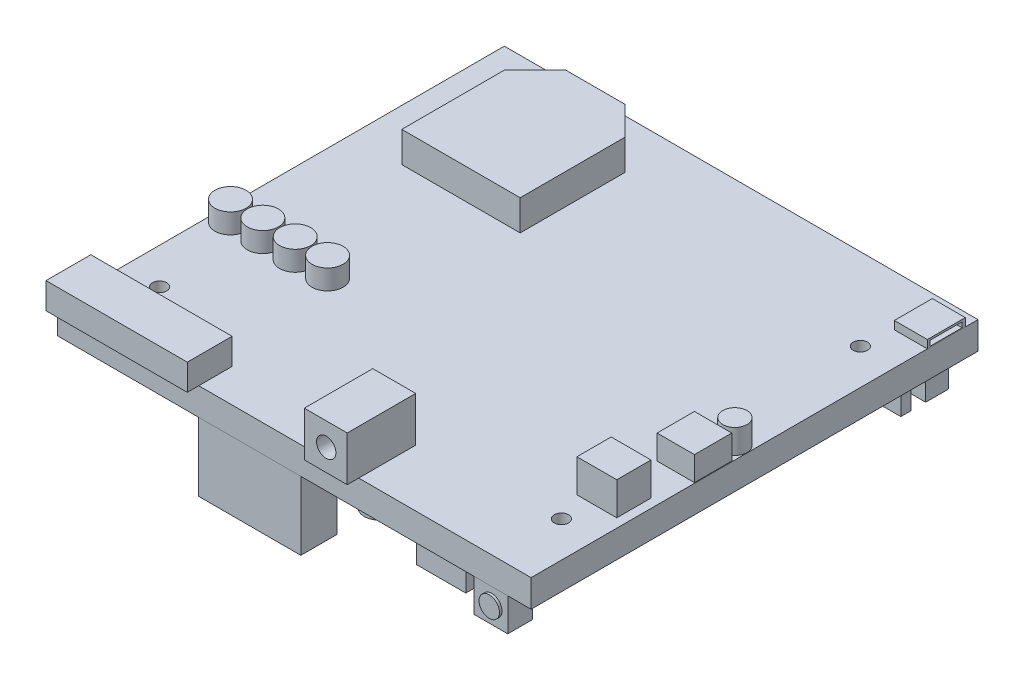
from build123d import *

# Parameters (mm, degrees)
SKETCH1_W             = 96.647
SKETCH1_H             = 91.186
BOSS_EXTRUDE1_DEPTH   = 5.588
BOSS_EXTRUDE2_DEPTH   = 6.223
SKETCH2_3_R           = 3.175
BOSS_EXTRUDE3_DEPTH   = 4.064
BOSS_EXTRUDE3_2_DEPTH = 4.064
BOSS_EXTRUDE3_3_DEPTH = 4.064
BOSS_EXTRUDE3_4_DEPTH = 4.064
SKETCH2_4_W           = 28.829
SKETCH2_4_H           = 9.144
BOSS_EXTRUDE4_DEPTH   = 5.334
SKETCH2_5_W           = 8.763
SKETCH2_5_H           = 13.97
BOSS_EXTRUDE5_DEPTH   = 9.144
SKETCH2_6_W           = 8.128
SKETCH2_6_H           = 6.985
BOSS_EXTRUDE6_DEPTH   = 6.731
SKETCH2_7_W           = 7.62
SKETCH2_7_H           = 7.62
BOSS_EXTRUDE7_DEPTH   = 4.953
SKETCH2_7_R           = 2.4765
BOSS_EXTRUDE7_2_DEPTH = 4.953
SKETCH2_8_W           = 6.731
SKETCH2_8_H           = 7.747
BOSS_EXTRUDE8_DEPTH   = 1.651
SKETCH3_W             = 20.32
SKETCH3_H             = 2.032
BOSS_EXTRUDE9_DEPTH   = 7.366
SKETCH3_H_2           = 4.699
BOSS_EXTRUDE9_2_DEPTH = 7.366
BOSS_EXTRUDE9_3_DEPTH = 7.366
BOSS_EXTRUDE9_4_DEPTH = 7.366
BOSS_EXTRUDE9_5_DEPTH = 7.366
BOSS_EXTRUDE9_6_DEPTH = 7.366
BOSS_EXTRUDE9_7_DEPTH = 7.366
BOSS_EXTRUDE9_8_DEPTH = 7.366
SKETCH4_W             = 20.828
SKETCH4_H             = 7.366
BOSS_EXTRUDE10_DEPTH  = 13.97
SKETCH5_W             = 25.019
SKETCH5_H             = 3.937
BOSS_EXTRUDE11_DEPTH  = 2.032
SKETCH6_R             = 3.048
BOSS_EXTRUDE12_DEPTH  = 6.35
SKETCH7_W             = 4.699
SKETCH7_H             = 4.699
BOSS_EXTRUDE13_DEPTH  = 1.651
SKETCH8_W             = 10.033
SKETCH8_H             = 10.033
BOSS_EXTRUDE14_DEPTH  = 5.08
SKETCH10_W            = 6.858
SKETCH10_H            = 5.08
BOSS_EXTRUDE15_DEPTH  = 6.731
SKETCH11_R            = 1.4605
CUT_EXTRUDE1_DEPTH    = 126.642876838
SKETCH13_W            = 6.502772336
SKETCH13_H            = 1.05238103
CUT_EXTRUDE3_DEPTH    = 2.54
SKETCH12_R            = 2.086347044
BOSS_EXTRUDE16_DEPTH  = 0.508
SKETCH14_R            = 1.973731767
CUT_EXTRUDE4_DEPTH    = 4.064


with BuildPart() as part:
    # Sketch1 → Boss-Extrude1 (new body)
    with BuildSketch(Plane(origin=(0, 0, 0), x_dir=(1, 0, 0), z_dir=(0, 1, 0))):
        with Locations((-36.848174165, 45.593)):
            Rectangle(SKETCH1_W, SKETCH1_H)
    extrude(amount=BOSS_EXTRUDE1_DEPTH)

    # Sketch2 → Boss-Extrude2 (add)
    with BuildSketch(Plane(origin=(0, 5.588, 0), x_dir=(1, 0, 0), z_dir=(0, 1, 0))):
        Polygon((-68.560074165, 86.995), (-74.706874165, 80.8482), (-74.706874165, 59.7916), (-50.551474165, 59.7916), (-50.551474165, 81.2038), (-56.342674165, 86.995), align=None)
    extrude(amount=BOSS_EXTRUDE2_DEPTH)

    # Sketch11 → Cut-Extrude1 (cut, through all)
    with BuildSketch(Plane.XZ):
        with Locations((-77.818374165, -13.4747)):
            Circle(SKETCH11_R)
        with Locations((-77.818374165, -74.4855)):
            Circle(SKETCH11_R)
        with Locations((4.172825835, -74.4855)):
            Circle(SKETCH11_R)
        with Locations((4.172825835, -13.4747)):
            Circle(SKETCH11_R)
    extrude(amount=-CUT_EXTRUDE1_DEPTH, mode=Mode.SUBTRACT)


with BuildPart() as body_2:
    # Sketch2<3> → Boss-Extrude3 (new body)
    with BuildSketch(Plane(origin=(0, 5.588, 0), x_dir=(1, 0, 0), z_dir=(0, 1, 0))):
        with Locations((-81.996674165, 32.131)):
            Circle(SKETCH2_3_R)
    extrude(amount=BOSS_EXTRUDE3_DEPTH)


with BuildPart() as body_3:
    # Sketch2<3> → Boss-Extrude3 2 (new body)
    with BuildSketch(Plane(origin=(0, 5.588, 0), x_dir=(1, 0, 0), z_dir=(0, 1, 0))):
        with Locations((-75.392674165, 32.131)):
            Circle(SKETCH2_3_R)
    extrude(amount=BOSS_EXTRUDE3_2_DEPTH)


with BuildPart() as body_4:
    # Sketch2<3> → Boss-Extrude3 3 (new body)
    with BuildSketch(Plane(origin=(0, 5.588, 0), x_dir=(1, 0, 0), z_dir=(0, 1, 0))):
        with Locations((-68.788674165, 32.131)):
            Circle(SKETCH2_3_R)
    extrude(amount=BOSS_EXTRUDE3_3_DEPTH)


with BuildPart() as body_5:
    # Sketch2<3> → Boss-Extrude3 4 (new body)
    with BuildSketch(Plane(origin=(0, 5.588, 0), x_dir=(1, 0, 0), z_dir=(0, 1, 0))):
        with Locations((-62.184674165, 32.131)):
            Circle(SKETCH2_3_R)
    extrude(amount=BOSS_EXTRUDE3_4_DEPTH)


with BuildPart() as body_6:
    # Sketch2<4> → Boss-Extrude4 (new body)
    with BuildSketch(Plane(origin=(0, 5.588, 0), x_dir=(1, 0, 0), z_dir=(0, 1, 0))):
        with Locations((-70.757174165, 2.2352)):
            Rectangle(SKETCH2_4_W, SKETCH2_4_H)
    extrude(amount=BOSS_EXTRUDE4_DEPTH)


with BuildPart() as body_7:
    # Sketch2<5> → Boss-Extrude5 (new body)
    with BuildSketch(Plane(origin=(0, 5.588, 0), x_dir=(1, 0, 0), z_dir=(0, 1, 0))):
        with Locations((-28.085174165, 4.6482)):
            Rectangle(SKETCH2_5_W, SKETCH2_5_H)
    extrude(amount=BOSS_EXTRUDE5_DEPTH)

    # Sketch14 → Cut-Extrude4 (cut)
    with BuildSketch(Plane.XY.offset(2.3368)):
        with Locations((-27.995813949, 10.054523758)):
            Circle(SKETCH14_R)
    extrude(amount=-CUT_EXTRUDE4_DEPTH, mode=Mode.SUBTRACT)


with BuildPart() as body_8:
    # Sketch2<6> → Boss-Extrude6 (new body)
    with BuildSketch(Plane(origin=(0, 5.588, 0), x_dir=(1, 0, 0), z_dir=(0, 1, 0))):
        with Locations((5.582525835, 22.7965)):
            Rectangle(SKETCH2_6_W, SKETCH2_6_H)
    extrude(amount=BOSS_EXTRUDE6_DEPTH)


with BuildPart() as body_9:
    # Sketch2<7> → Boss-Extrude7 (new body)
    with BuildSketch(Plane(origin=(0, 5.588, 0), x_dir=(1, 0, 0), z_dir=(0, 1, 0))):
        with Locations((7.538325835, 37.2618)):
            Rectangle(SKETCH2_7_W, SKETCH2_7_H)
    extrude(amount=BOSS_EXTRUDE7_DEPTH)


with BuildPart() as body_10:
    # Sketch2<7> → Boss-Extrude7 2 (new body)
    with BuildSketch(Plane(origin=(0, 5.588, 0), x_dir=(1, 0, 0), z_dir=(0, 1, 0))):
        with Locations((8.935325835, 44.1198)):
            Circle(SKETCH2_7_R)
    extrude(amount=BOSS_EXTRUDE7_2_DEPTH)


with BuildPart() as body_11:
    # Sketch2<8> → Boss-Extrude8 (new body)
    with BuildSketch(Plane(origin=(0, 5.588, 0), x_dir=(1, 0, 0), z_dir=(0, 1, 0))):
        with Locations((8.109825835, 84.7217)):
            Rectangle(SKETCH2_8_W, SKETCH2_8_H)
    extrude(amount=BOSS_EXTRUDE8_DEPTH)

    # Sketch13 → Cut-Extrude3 (cut)
    with BuildSketch(Plane(origin=(11.475325835, 0, 0), x_dir=(0, 0, -1), z_dir=(1, 0, 0))):
        with Locations((84.686002297, 6.299052732)):
            Rectangle(SKETCH13_W, SKETCH13_H)
    extrude(amount=-CUT_EXTRUDE3_DEPTH, mode=Mode.SUBTRACT)


with BuildPart() as body_12:
    # Sketch3 → Boss-Extrude9 (new body)
    with BuildSketch(Plane.XZ):
        with Locations((-71.328674165, -80.137)):
            Rectangle(SKETCH3_W, SKETCH3_H)
    extrude(amount=BOSS_EXTRUDE9_DEPTH)


with BuildPart() as body_13:
    # Sketch3 → Boss-Extrude9 2 (new body)
    with BuildSketch(Plane.XZ):
        with Locations((-71.328674165, -86.5505)):
            Rectangle(SKETCH3_W, SKETCH3_H_2)
    extrude(amount=BOSS_EXTRUDE9_2_DEPTH)


with BuildPart() as body_14:
    # Sketch3 → Boss-Extrude9 3 (new body)
    with BuildSketch(Plane.XZ):
        with Locations((-48.341674165, -80.137)):
            Rectangle(SKETCH3_W, SKETCH3_H)
    extrude(amount=BOSS_EXTRUDE9_3_DEPTH)


with BuildPart() as body_15:
    # Sketch3 → Boss-Extrude9 4 (new body)
    with BuildSketch(Plane.XZ):
        with Locations((-48.341674165, -86.5505)):
            Rectangle(SKETCH3_W, SKETCH3_H_2)
    extrude(amount=BOSS_EXTRUDE9_4_DEPTH)


with BuildPart() as body_16:
    # Sketch3 → Boss-Extrude9 5 (new body)
    with BuildSketch(Plane.XZ):
        with Locations((-25.354674165, -80.137)):
            Rectangle(SKETCH3_W, SKETCH3_H)
    extrude(amount=BOSS_EXTRUDE9_5_DEPTH)


with BuildPart() as body_17:
    # Sketch3 → Boss-Extrude9 6 (new body)
    with BuildSketch(Plane.XZ):
        with Locations((-25.354674165, -86.5505)):
            Rectangle(SKETCH3_W, SKETCH3_H_2)
    extrude(amount=BOSS_EXTRUDE9_6_DEPTH)


with BuildPart() as body_18:
    # Sketch3 → Boss-Extrude9 7 (new body)
    with BuildSketch(Plane.XZ):
        with Locations((-2.367674165, -80.137)):
            Rectangle(SKETCH3_W, SKETCH3_H)
    extrude(amount=BOSS_EXTRUDE9_7_DEPTH)


with BuildPart() as body_19:
    # Sketch3 → Boss-Extrude9 8 (new body)
    with BuildSketch(Plane.XZ):
        with Locations((-2.367674165, -86.5505)):
            Rectangle(SKETCH3_W, SKETCH3_H_2)
    extrude(amount=BOSS_EXTRUDE9_8_DEPTH)


with BuildPart() as body_20:
    # Sketch4 → Boss-Extrude10 (new body)
    with BuildSketch(Plane.XZ):
        with Locations((-45.928674165, -3.683)):
            Rectangle(SKETCH4_W, SKETCH4_H)
    extrude(amount=BOSS_EXTRUDE10_DEPTH)


with BuildPart() as body_21:
    # Sketch5 → Boss-Extrude11 (new body)
    with BuildSketch(Plane.XZ):
        with Locations((-36.721174165, -48.9585)):
            Rectangle(SKETCH5_W, SKETCH5_H)
    extrude(amount=BOSS_EXTRUDE11_DEPTH)


with BuildPart() as body_22:
    # Sketch6 → Boss-Extrude12 (new body)
    with BuildSketch(Plane.XZ):
        with Locations((-28.275674165, -8.763)):
            Circle(SKETCH6_R)
    extrude(amount=BOSS_EXTRUDE12_DEPTH)


with BuildPart() as body_23:
    # Sketch7 → Boss-Extrude13 (new body)
    with BuildSketch(Plane.XZ):
        with Locations((-20.719174165, -9.4615)):
            Rectangle(SKETCH7_W, SKETCH7_H)
    extrude(amount=BOSS_EXTRUDE13_DEPTH)


with BuildPart() as body_24:
    # Sketch8 → Boss-Extrude14 (new body)
    with BuildSketch(Plane.XZ):
        with Locations((-8.146174165, -6.2865)):
            Rectangle(SKETCH8_W, SKETCH8_H)
    extrude(amount=BOSS_EXTRUDE14_DEPTH)


with BuildPart() as body_25:
    # Sketch10 → Boss-Extrude15 (new body)
    with BuildSketch(Plane.XZ):
        with Locations((3.283825835, -2.54)):
            Rectangle(SKETCH10_W, SKETCH10_H)
    extrude(amount=BOSS_EXTRUDE15_DEPTH)

    # Sketch12 → Boss-Extrude16 (add)
    with BuildSketch(Plane.XY):
        with Locations((3.443826311, -3.295057074)):
            Circle(SKETCH12_R)
    extrude(amount=BOSS_EXTRUDE16_DEPTH)


solid = Compound([part.part, body_2.part, body_3.part, body_4.part, body_5.part, body_6.part, body_7.part, body_8.part, body_9.part, body_10.part, body_11.part, body_12.part, body_13.part, body_14.part, body_15.part, body_16.part, body_17.part, body_18.part, body_19.part, body_20.part, body_21.part, body_22.part, body_23.part, body_24.part, body_25.part])
